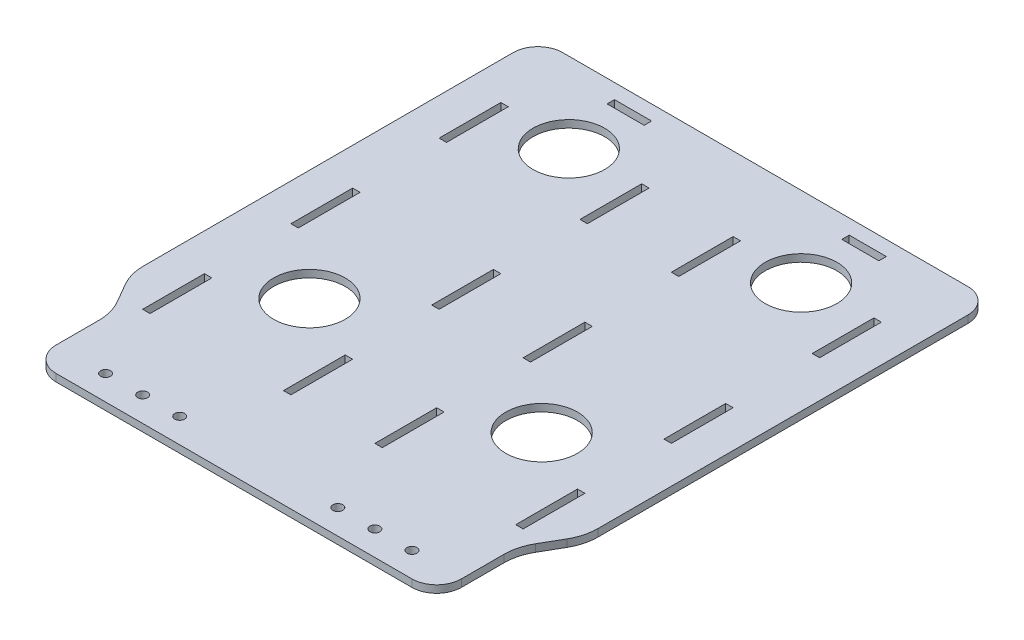
from build123d import *

# Parameters (mm, degrees)
SKETCH_1_W          = 164
SKETCH_1_H          = 215
SKETCH_1_R          = 14.5
EXTRUDE_1_DEPTH     = 3
SKETCH_2_R          = 2
CUT_EXTRUDE_1_DEPTH = 3
SKETCH_3_W          = 3
SKETCH_3_H          = 25
CUT_EXTRUDE_2_DEPTH = 10
SKETCH_4_W          = 15
SKETCH_4_H          = 3
CUT_EXTRUDE_3_DEPTH = 10
SKETCH_6_W          = 10
SKETCH_6_H          = 190
EXTRUDE_2_DEPTH     = 3
CHAMFER_1_SIZE      = 25
CHAMFER_1_SIZE_2    = 14.43375673
FILLET_3_R          = 20
FILLET_4_R          = 10


with BuildPart() as part:
    # 草图1 → 凸台-拉伸1 (new body)
    with BuildSketch(Plane(origin=(0, 0, 0), x_dir=(1, 0, 0), z_dir=(0, 1, 0))):
        with Locations((47, 70)):
            Rectangle(SKETCH_1_W, SKETCH_1_H)
        with Locations(Location((94, 40, 0), (0, 0, 270))):
            Circle(SKETCH_1_R, mode=Mode.SUBTRACT)
        with Locations(Location((0, 40, 0), (0, 0, 270))):
            Circle(SKETCH_1_R, mode=Mode.SUBTRACT)
        with Locations(Location((0, 145, 0), (0, 0, 270))):
            Circle(SKETCH_1_R, mode=Mode.SUBTRACT)
        with Locations(Location((94, 145, 0), (0, 0, 270))):
            Circle(SKETCH_1_R, mode=Mode.SUBTRACT)
    extrude(amount=EXTRUDE_1_DEPTH)

    # 草图2 → 切除-拉伸1 (cut)
    with BuildSketch(Plane(origin=(0, 3, 0), x_dir=(1, 0, 0), z_dir=(0, 1, 0))):
        with Locations(Location((0, -27.5, 0), (0, 0, 270))):
            Circle(SKETCH_2_R)
        with Locations(Location((-15, -27.5, 0), (0, 0, 270))):
            Circle(SKETCH_2_R)
        with Locations(Location((15, -27.5, 0), (0, 0, 90))):
            Circle(SKETCH_2_R)
        with Locations(Location((79, -27.5, 0), (0, 0, 270))):
            Circle(SKETCH_2_R)
        with Locations(Location((109, -27.5, 0), (0, 0, 90))):
            Circle(SKETCH_2_R)
        with Locations(Location((94, -27.5, 0), (0, 0, 90))):
            Circle(SKETCH_2_R)
    extrude(amount=-CUT_EXTRUDE_1_DEPTH, mode=Mode.SUBTRACT)

    # 草图3 → 切除-拉伸2 (cut)
    with BuildSketch(Plane(origin=(0, 3, 0), x_dir=(1, 0, 0), z_dir=(0, 1, 0))):
        with Locations((28.5, 135)):
            Rectangle(SKETCH_3_W, SKETCH_3_H)
        with Locations((65.5, 135)):
            Rectangle(SKETCH_3_W, SKETCH_3_H)
        with Locations((28.5, 75)):
            Rectangle(SKETCH_3_W, SKETCH_3_H)
        with Locations((65.5, 75)):
            Rectangle(SKETCH_3_W, SKETCH_3_H)
        with Locations((28.5, 15)):
            Rectangle(SKETCH_3_W, SKETCH_3_H)
        with Locations((65.5, 15)):
            Rectangle(SKETCH_3_W, SKETCH_3_H)
        with Locations((-28.5, 15)):
            Rectangle(SKETCH_3_W, SKETCH_3_H)
        with Locations((-28.5, 75)):
            Rectangle(SKETCH_3_W, SKETCH_3_H)
        with Locations((-28.5, 135)):
            Rectangle(SKETCH_3_W, SKETCH_3_H)
        with Locations((122.5, 135)):
            Rectangle(SKETCH_3_W, SKETCH_3_H)
        with Locations((122.5, 75)):
            Rectangle(SKETCH_3_W, SKETCH_3_H)
        with Locations((122.5, 15)):
            Rectangle(SKETCH_3_W, SKETCH_3_H)
    extrude(amount=-CUT_EXTRUDE_2_DEPTH, mode=Mode.SUBTRACT)

    # 草图4 → 切除-拉伸3 (cut)
    with BuildSketch(Plane(origin=(0, 3, 0), x_dir=(1, 0, 0), z_dir=(0, 1, 0))):
        with Locations((-0.5, 170)):
            Rectangle(SKETCH_4_W, SKETCH_4_H)
        with Locations((94.5, 170)):
            Rectangle(SKETCH_4_W, SKETCH_4_H)
    extrude(amount=-CUT_EXTRUDE_3_DEPTH, mode=Mode.SUBTRACT)

    # 草图6 → 凸台-拉伸2 (add)
    with BuildSketch(Plane(origin=(0, 3, 0), x_dir=(1, 0, 0), z_dir=(0, 1, 0))):
        with Locations((-40, 82.5)):
            Rectangle(SKETCH_6_W, SKETCH_6_H)
        with Locations((134, 82.5)):
            Rectangle(SKETCH_6_W, SKETCH_6_H)
    extrude(amount=-EXTRUDE_2_DEPTH)

    # 倒角1
    # the kernel refuses this chamfer: 25, 14.43375673 mm, written as the material it takes off along each edge
    with BuildSketch(Plane(origin=(139, 67.677143866, 12.5), x_dir=(0.019326765612700705, 0, -0.9998132206222079), z_dir=(0, -1, 0))) as chamfer_1_piece_1_section:
        Polygon((CHAMFER_1_SIZE * 0.999813220622, -CHAMFER_1_SIZE * 0.0193267656127), (-CHAMFER_1_SIZE_2 * 0.0193267656124, -CHAMFER_1_SIZE_2 * 0.999813220604), (0, 0), align=None)
    chamfer_1_piece_1 = extrude(amount=132.354287732, mode=Mode.PRIVATE)
    chamfer_1_piece_1 = split(chamfer_1_piece_1, bisect_by=Plane(origin=(129, 1.5, 3.344472452), z_dir=(1, 0, 0)), keep=Keep.TOP, mode=Mode.PRIVATE)
    add(chamfer_1_piece_1, mode=Mode.SUBTRACT)
    with BuildSketch(Plane(origin=(-45, 67.677143866, 12.5), x_dir=(0.9983227437537926, 0, 0.057893862402670776), z_dir=(0, -1, 0))) as chamfer_1_piece_2_section:
        Polygon((CHAMFER_1_SIZE_2 * 0.998322743736, -CHAMFER_1_SIZE_2 * 0.0578938624016), (-CHAMFER_1_SIZE * 0.0578938624027, -CHAMFER_1_SIZE * 0.998322743754), (0, 0), align=None)
    chamfer_1_piece_2 = extrude(amount=132.354287732, mode=Mode.PRIVATE)
    chamfer_1_piece_2 = split(chamfer_1_piece_2, bisect_by=Plane(origin=(-35, 1.5, 3.344472452), z_dir=(-1, 0, 0)), keep=Keep.TOP, mode=Mode.PRIVATE)
    add(chamfer_1_piece_2, mode=Mode.SUBTRACT)

    # 圆角3
    fillet_3_edges = [part.edges().sort_by_distance(p)[0] for p in [
        (139, 1.5, -12.5),
        (-45, 1.5, -12.5),
        (129, 1.5, 4.820508076),
        (-35, 1.5, 4.820508076),
    ]]
    fillet(fillet_3_edges, radius=FILLET_3_R)

    # 圆角4
    fillet_4_edges = [part.edges().sort_by_distance(p)[0] for p in [
        (-35, 1.5, 37.5),
        (129, 1.5, 37.5),
        (-45, 1.5, -177.5),
        (139, 1.5, -177.5),
    ]]
    fillet(fillet_4_edges, radius=FILLET_4_R)


solid = part.part
